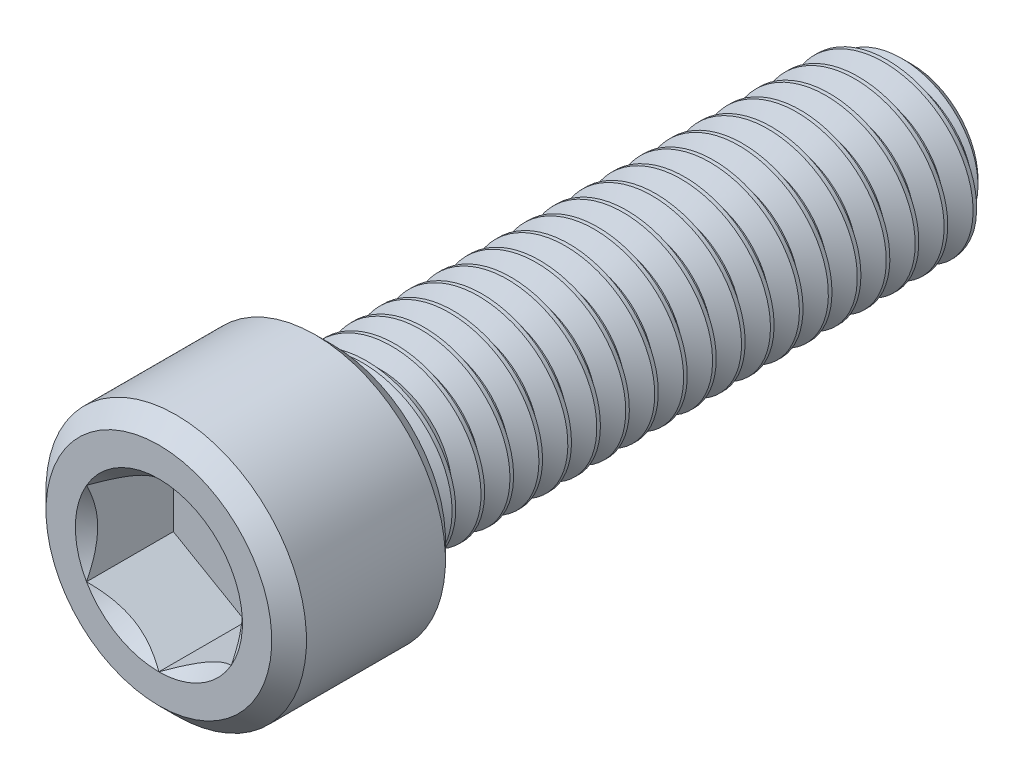
from build123d import *

# Parameters (mm, degrees)
CUT_EXTRUDE1_DEPTH = 4.7625
CUT_SWEEP1_PITCH   = 1.5875
CUT_SWEEP1_TO      = 31.75


with BuildPart() as part:
    # Sketch3 → Revolve1 (revolve)
    with BuildSketch(Plane(origin=(0, 0, 0), x_dir=(0, 0, -1), z_dir=(1, 0, 0))):
        Polygon((20.6375, 0), (-20.6375, 0), (-20.6375, 6.19125), (-19.685, 7.14375), (-12.065, 7.14375), (-11.1125, 6.19125), (-11.1125, 4.7625), (19.52625, 4.7625), (20.6375, 3.65125), align=None)
    revolve(axis=Axis((0, 0, -20.6375), (0, 0, 1)))

    # Sketch4 → Cut-Extrude1 (cut)
    with BuildSketch(Plane.XY.offset(20.6375)):
        Polygon((0, -4.582717762), (3.96875, -2.291358881), (3.96875, 2.291358881), (0, 4.582717762), (-3.96875, 2.291358881), (-3.96875, -2.291358881), align=None)
    extrude(amount=-CUT_EXTRUDE1_DEPTH, mode=Mode.SUBTRACT)

    # Cut-Extrude3 cone 1 section (through the dimple's axis) → Cut-Extrude3 (revolve, cut)
    with BuildSketch(Plane(origin=(0, 0, 20.6375), x_dir=(0, -1, 0), z_dir=(1, 0, 0))):
        Polygon((0, 0), (4.582717762, 0), (0, 4.582717762), align=None)
    revolve(axis=Axis((0, 0, 20.6375), (0, 0, -1)), mode=Mode.SUBTRACT)


with BuildPart() as body_2:
    # Split1: read off the stored shape, not the designer's step
    # Split1: the piece on the far side of the plane
    add(part.part)
    split(bisect_by=Plane.XY.offset(11.1125), keep=Keep.BOTTOM)

    # Cut-Sweep1: arcs per turn and ends read off the stored shape
    # Cut-Sweep1: the profile of Sketch7 screwed along a right-hand helix through 21 turns, 8 arcs to a turn; built about Z, then put on its axis
    cut_sweep1_z = Axis((0, 0, 0), (0, 0, 1))
    cut_sweep1_corners = [(4.848425958, 0, 0.049609375), (4.848425958, 0, -1.438671875), (3.731388504, 0, -0.79375), (3.731388504, 0, -0.5953125)]
    with BuildLine(mode=Mode.PRIVATE) as cut_sweep1_profile:
        Line(cut_sweep1_corners[0], cut_sweep1_corners[1])
        Line(cut_sweep1_corners[1], cut_sweep1_corners[2])
        Line(cut_sweep1_corners[2], cut_sweep1_corners[3])
        Line(cut_sweep1_corners[3], cut_sweep1_corners[0])
    cut_sweep1_cap = Face(cut_sweep1_profile.wire())
    cut_sweep1_turn_angles = [0, 22.5, 45, 67.5, 90, 112.5, 135, 157.5, 180, 202.5, 225, 247.5, 270, 292.5, 315, 337.5, 360]
    cut_sweep1_turn_weights = [1, 0.9238795325112867, 1, 0.9238795325112867, 1, 0.9238795325112867, 1, 0.9238795325112867, 1, 0.9238795325112867, 1, 0.9238795325112867, 1, 0.9238795325112867, 1, 0.9238795325112867, 1]
    cut_sweep1_turn_rails = [Edge.make_bspline([Vector(p[0], p[1], 0).rotate(cut_sweep1_z, cut_sweep1_turn_angles[k]) / cut_sweep1_turn_weights[k] + Vector(0, 0, p[2] + CUT_SWEEP1_PITCH * cut_sweep1_turn_angles[k] / 360) for k in range(17)], [0, 0, 0, 1, 1, 2, 2, 3, 3, 4, 4, 5, 5, 6, 6, 7, 7, 8, 8, 8], 2, cut_sweep1_turn_weights) for p in cut_sweep1_corners]
    cut_sweep1_turn_sides = [Face.make_surface_from_curves(cut_sweep1_turn_rails[p[0]], cut_sweep1_turn_rails[p[1]]) for p in [(0, 1), (1, 2), (2, 3), (3, 0)]]
    cut_sweep1 = Plane(origin=(0, 0, -20.6375), x_dir=(0, 1, 0), z_dir=(0, 0, 1)) * split(Solid(Shell([*[p.moved(Location((0, 0, CUT_SWEEP1_PITCH * i))) for i in range(21) for p in cut_sweep1_turn_sides], cut_sweep1_cap, cut_sweep1_cap.rotate(cut_sweep1_z, 7560).moved(Location((0, 0, CUT_SWEEP1_PITCH * 7560 / 360)))])), bisect_by=Plane.XY.offset(CUT_SWEEP1_TO), keep=Keep.BOTTOM, mode=Mode.PRIVATE)
    add(cut_sweep1, mode=Mode.SUBTRACT)


with BuildPart() as part_1:
    add(part.part)

    # Split1
    split(bisect_by=Plane.XY.offset(11.1125), keep=Keep.TOP)

    add(body_2.part)  # Boss-Extrude1 merges body 2
    # Boss-Extrude1: read off the stored shape, not the designer's step
    # Boss-Extrude1 outline → Boss-Extrude1 (revolve)
    with BuildSketch(Plane.XZ):
        Polygon((3.731388242, 11.1125), (3.731388242, 8.279543727), (4.7625, 11.1125), align=None)
    revolve(axis=Axis((0, 0, 0), (0, 0, 1)))


solid = part_1.part
